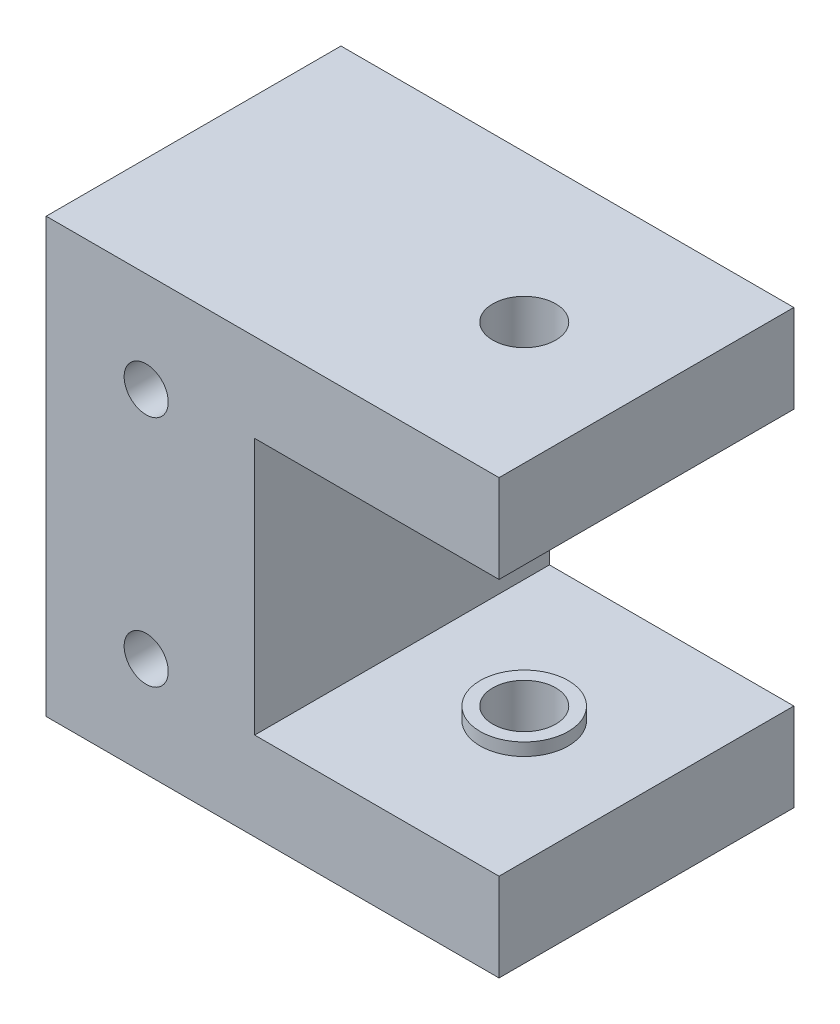
from build123d import *

# Parameters (mm, degrees)
MAINBLOCK_R                     = 1.75
MAINBLOCKBOSS_EXTRUDE1_DEPTH    = 23.4
TOPHOLECUT_SKETCH2_R            = 2.5
TOPHOLECUT_EXTRUDE1_DEPTH       = 30
TOPSPACERSKETCH4_R              = 3.5
TOPSPACERSKETCH4_R_2            = 2.5
TOPSPACERBOSS_EXTRUDE2_DEPTH    = 1
LOWERSPACERBOSS_EXTRUDE3_START  = 1
LOWERSPACERSKETCH5_R            = 3.5
LOWERSPACERSKETCH5_R_2          = 2.5
LOWERSPACERBOSS_EXTRUDE3_DEPTH  = 1
MOUNTHOLEBORECUT_EXTRUDE1_DEPTH = 2
PUSHPINHOLESKETCH1_R            = 1
PUSHPINHOLECUT_EXTRUDE1_DEPTH   = 55.984747885


with BuildPart() as part:
    # MainBlock → MainBlockBoss-Extrude1 (new body)
    with BuildSketch(Plane.XY):
        Polygon((0, 0), (35.95, 0), (35.95, 7), (16.55, 7), (16.55, 27.4), (35.95, 27.4), (35.95, 34.4), (0, 34.4), align=None)
        with Locations((7.9375, 26.4625)):
            Circle(MAINBLOCK_R, mode=Mode.SUBTRACT)
        with Locations((7.9375, 7.9375)):
            Circle(MAINBLOCK_R, mode=Mode.SUBTRACT)
    extrude(amount=MAINBLOCKBOSS_EXTRUDE1_DEPTH)

    # TopHoleCut-Sketch2 → TopHoleCut-Extrude1 (cut)
    with BuildSketch(Plane(origin=(0, 34.4, 0), x_dir=(1, 0, 0), z_dir=(0, 1, 0))):
        with Locations((26.25, -11.7)):
            Circle(TOPHOLECUT_SKETCH2_R)
    extrude(amount=-TOPHOLECUT_EXTRUDE1_DEPTH, mode=Mode.SUBTRACT)

    # TopSpacerSketch4 → TopSpacerBoss-Extrude2 (add)
    with BuildSketch(Plane.XZ.offset(-27.4)):
        with Locations((26.25, 11.7)):
            Circle(TOPSPACERSKETCH4_R)
        with Locations((26.25, 11.7)):
            Circle(TOPSPACERSKETCH4_R_2, mode=Mode.SUBTRACT)
    extrude(amount=TOPSPACERBOSS_EXTRUDE2_DEPTH)

    # LowerSpacerSketch5 → LowerSpacerBoss-Extrude3 (add)
    with BuildSketch(Plane(origin=(0, 7, 0), x_dir=(1, 0, 0), z_dir=(0, 1, 0)).offset(LOWERSPACERBOSS_EXTRUDE3_START)):
        with Locations((26.25, -11.7)):
            Circle(LOWERSPACERSKETCH5_R)
        with Locations((26.25, -11.7)):
            Circle(LOWERSPACERSKETCH5_R_2, mode=Mode.SUBTRACT)
    extrude(amount=-LOWERSPACERBOSS_EXTRUDE3_DEPTH)

    # MountHoleBoreSketch1 → MountHoleBoreCut-Extrude1 (cut)
    with BuildSketch(Plane(origin=(0, 0, 0), x_dir=(-1, 0, 0), z_dir=(0, 0, -1))):
        Polygon((-5.1875, 26.4625), (-6.5625, 28.84406986), (-9.3125, 28.84406986), (-10.6875, 26.4625), (-9.3125, 24.08093014), (-6.5625, 24.08093014), align=None)
        Polygon((-5.1875, 7.9375), (-6.5625, 10.31906986), (-9.3125, 10.31906986), (-10.6875, 7.9375), (-9.3125, 5.55593014), (-6.5625, 5.55593014), align=None)
    extrude(amount=-MOUNTHOLEBORECUT_EXTRUDE1_DEPTH, mode=Mode.SUBTRACT)

    # PushPinHoleSketch1 → PushPinHoleCut-Extrude1 (cut, through all)
    with BuildSketch(Plane.XZ):
        with Locations((26.25, 11.7)):
            Circle(PUSHPINHOLESKETCH1_R)
    extrude(amount=-PUSHPINHOLECUT_EXTRUDE1_DEPTH, mode=Mode.SUBTRACT)


solid = part.part
